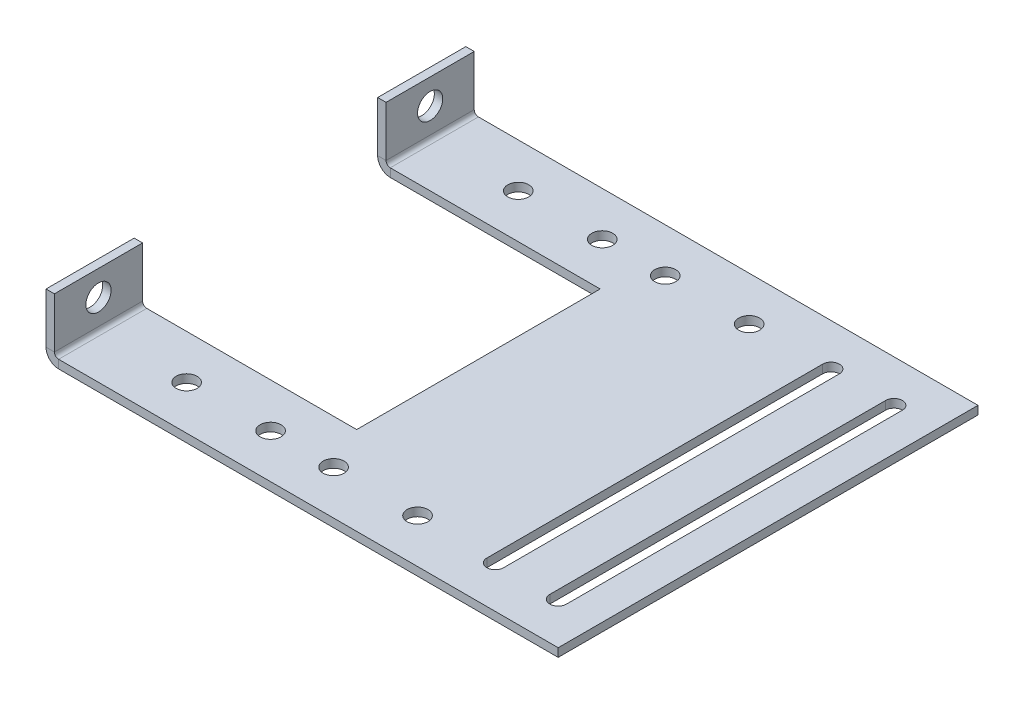
from build123d import *

# Parameters (mm, degrees)
BASE_FLANGE1_DEPTH      = 100
SKETCH8_W               = 29
SKETCH8_H               = 12
SKETCH8_R               = 3
CUT_EXTRUDE1_DEPTH      = 159.28139499
CUT_EXTRUDE2_DEPTH      = 157.74501587
CUT_EXTRUDE2_DEPTH_BACK = 157.74501587
CUT_EXTRUDE4_START      = -2
CUT_EXTRUDE4_OUTLINE_W  = 3
CUT_EXTRUDE4_OUTLINE_H  = 58
CUT_EXTRUDE4_DEPTH      = 3
CUT_EXTRUDE5_DEPTH      = 157.74501587
CUT_EXTRUDE5_DEPTH_BACK = 157.74501587
SKETCH11_W              = 50
SKETCH11_H              = 58
CUT_EXTRUDE6_DEPTH      = 157.74501587
CUT_EXTRUDE6_DEPTH_BACK = 157.74501587
SKETCH12_R              = 2.5


# Read off the part's stored shape, not the designer's step: Cut-Extrude4
# Sheet-metal steps are written as plain solids
with BuildPart() as part:
    # Sketch1 → Base-Flange1 (new body)
    with BuildSketch(Plane.XY):
        with BuildLine():
            Line((0, 13), (0, 1))
            ThreePointArc((0, 1), (0.292893219, 0.292893219), (1, 0))
            Line((1, 0), (120, 0))
            Line((120, 0), (120, -2))
            Line((120, -2), (1, -2))
            ThreePointArc((1, -2), (-1.121320344, -1.121320344), (-2, 1))
            Line((-2, 1), (-2, 13))
            Line((-2, 13), (0, 13))
        make_face()
    extrude(amount=BASE_FLANGE1_DEPTH)

    # Sketch8 → Cut-Extrude1 (cut, through all)
    with BuildSketch(Plane.ZY.offset(2)):
        with Locations((35.5, 7)):
            Rectangle(SKETCH8_W, SKETCH8_H)
        with Locations((64.5, 7)):
            Rectangle(SKETCH8_W, SKETCH8_H)
        with Locations((10.5, 7)):
            Circle(SKETCH8_R)
        with Locations((89.5, 7)):
            Circle(SKETCH8_R)
    extrude(amount=-CUT_EXTRUDE1_DEPTH, mode=Mode.SUBTRACT)

    # Sketch9 → Cut-Extrude2 (cut, two sides: drawn at the far end of the back side and taken through both)
    with BuildSketch(Plane(origin=(0, 0, 0), x_dir=(1, 0, 0), z_dir=(0, 1, 0)).offset(-CUT_EXTRUDE2_DEPTH_BACK)):
        with BuildLine():
            Line((112, -10), (112, -90))
            ThreePointArc((112, -90), (110, -92), (108, -90))
            Line((108, -90), (108, -10))
            ThreePointArc((108, -10), (110, -8), (112, -10))
        make_face()
        with BuildLine():
            Line((93, -10), (93, -90))
            ThreePointArc((93, -90), (95, -92), (97, -90))
            Line((97, -90), (97, -10))
            ThreePointArc((97, -10), (95, -8), (93, -10))
        make_face()
    extrude(amount=CUT_EXTRUDE2_DEPTH + CUT_EXTRUDE2_DEPTH_BACK, mode=Mode.SUBTRACT)

    # Cut-Extrude4 outline → Cut-Extrude4 (cut)
    with BuildSketch(Plane(origin=(0, 0, 0), x_dir=(1, 0, 0), z_dir=(0, 1, 0)).offset(CUT_EXTRUDE4_START)):
        with Locations((-0.5, -50)):
            Rectangle(CUT_EXTRUDE4_OUTLINE_W, CUT_EXTRUDE4_OUTLINE_H)
    extrude(amount=CUT_EXTRUDE4_DEPTH, mode=Mode.SUBTRACT)

    # Sketch11 → Cut-Extrude5 (cut, two sides: drawn at the far end of the back side and taken through both)
    with BuildSketch(Plane(origin=(0, 0, 0), x_dir=(1, 0, 0), z_dir=(0, 1, 0)).offset(-CUT_EXTRUDE5_DEPTH_BACK)):
        with Locations((26, -50)):
            Rectangle(SKETCH11_W, SKETCH11_H)
    extrude(amount=CUT_EXTRUDE5_DEPTH + CUT_EXTRUDE5_DEPTH_BACK, mode=Mode.SUBTRACT)

    # Sketch12 → Cut-Extrude6 (cut, two sides: drawn at the far end of the back side and taken through both)
    with BuildSketch(Plane(origin=(0, 0, 0), x_dir=(1, 0, 0), z_dir=(0, 1, 0)).offset(-CUT_EXTRUDE6_DEPTH_BACK)):
        with Locations(Location((21, -10.5, 0), (0, 0, 270))):
            Circle(SKETCH12_R)
        with Locations(Location((41, -10.5, 0), (0, 0, 270))):
            Circle(SKETCH12_R)
        with Locations(Location((21, -89.5, 0), (0, 0, 270))):
            Circle(SKETCH12_R)
        with Locations(Location((41, -89.5, 0), (0, 0, 270))):
            Circle(SKETCH12_R)
        with Locations(Location((76, -89.5, 0), (0, 0, 270))):
            Circle(SKETCH12_R)
        with Locations(Location((56, -89.5, 0), (0, 0, 270))):
            Circle(SKETCH12_R)
        with Locations(Location((56, -10.5, 0), (0, 0, 270))):
            Circle(SKETCH12_R)
        with Locations(Location((76, -10.5, 0), (0, 0, 270))):
            Circle(SKETCH12_R)
    extrude(amount=CUT_EXTRUDE6_DEPTH + CUT_EXTRUDE6_DEPTH_BACK, mode=Mode.SUBTRACT)


solid = part.part
